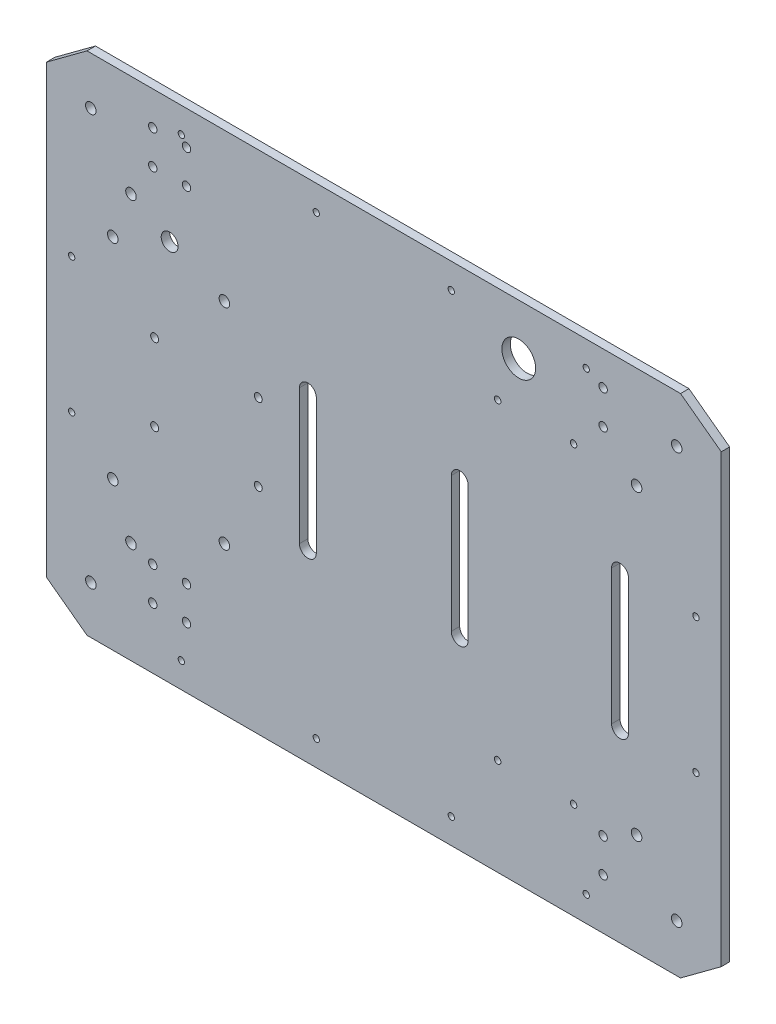
from build123d import *

# Parameters (mm, degrees)
SKETCH1_R           = 1.984375
BOSS_EXTRUDE1_DEPTH = 3.175
SKETCH2_R           = 1.213592974
CUT_EXTRUDE1_DEPTH  = 159.781746826
SKETCH5_R           = 3.175
SKETCH5_R_2         = 6.35
SKETCH5_R_3         = 1.5875
SKETCH5_R_4         = 1.984375
SKETCH5_R_5         = 1.5
CUT_EXTRUDE2_DEPTH  = 159.781746826
SKETCH6_R           = 1.190625
CUT_EXTRUDE3_DEPTH  = 159.781746826


with BuildPart() as part:
    # Sketch1 → Boss-Extrude1 (new body)
    with BuildSketch(Plane.XY):
        Polygon((-111.686526805, -95.25), (-127, -83.918625912), (-127, 83.918625912), (-111.686526805, 95.25), (111.686526805, 95.25), (127, 83.918625912), (127, -83.918625912), (111.686526805, -95.25), align=None)
        with Locations((-95.147512794, 56.885632681)):
            Circle(SKETCH1_R, mode=Mode.SUBTRACT)
        with Locations((-110.256011578, 77.303596941)):
            Circle(SKETCH1_R, mode=Mode.SUBTRACT)
        with Locations((110.256011578, 77.303596941)):
            Circle(SKETCH1_R, mode=Mode.SUBTRACT)
        with Locations((95.147512794, 56.885632681)):
            Circle(SKETCH1_R, mode=Mode.SUBTRACT)
        with Locations((-110.256011578, -77.303596941)):
            Circle(SKETCH1_R, mode=Mode.SUBTRACT)
        with Locations((-95.147512794, -56.885632681)):
            Circle(SKETCH1_R, mode=Mode.SUBTRACT)
        with Locations((110.256011578, -77.303596941)):
            Circle(SKETCH1_R, mode=Mode.SUBTRACT)
        with Locations((95.147512794, -56.885632681)):
            Circle(SKETCH1_R, mode=Mode.SUBTRACT)
    extrude(amount=BOSS_EXTRUDE1_DEPTH)

    # Sketch2 → Cut-Extrude1 (cut, through all)
    with BuildSketch(Plane.XY.offset(3.175)):
        with Locations((42.8625, 58.7375)):
            Circle(SKETCH2_R)
        with Locations((42.8625, -58.7375)):
            Circle(SKETCH2_R)
        with Locations((71.4375, -58.7375)):
            Circle(SKETCH2_R)
        with Locations((71.4375, 58.7375)):
            Circle(SKETCH2_R)
    extrude(amount=-CUT_EXTRUDE1_DEPTH, mode=Mode.SUBTRACT)

    # Sketch5 → Cut-Extrude2 (cut, through all)
    with BuildSketch(Plane(origin=(0, 0, 0), x_dir=(-1, 0, 0), z_dir=(0, 0, -1))):
        with BuildLine():
            Line((-85.725, -25.4), (-85.725, 25.4))
            ThreePointArc((-85.725, 25.4), (-88.9, 28.575), (-92.075, 25.4))
            Line((-92.075, 25.4), (-92.075, -25.4))
            ThreePointArc((-92.075, -25.4), (-88.9, -28.575), (-85.725, -25.4))
        make_face()
        with BuildLine():
            Line((-25.4, -25.4), (-25.4, 25.4))
            ThreePointArc((-25.4, 25.4), (-28.575, 28.575), (-31.75, 25.4))
            Line((-31.75, 25.4), (-31.75, -25.4))
            ThreePointArc((-31.75, -25.4), (-28.575, -28.575), (-25.4, -25.4))
        make_face()
        with BuildLine():
            ThreePointArc((31.75, 25.4), (28.575, 28.575), (25.4, 25.4))
            Line((25.4, 25.4), (25.4, -25.4))
            ThreePointArc((25.4, -25.4), (28.575, -28.575), (31.75, -25.4))
            Line((31.75, -25.4), (31.75, 25.4))
        make_face()
        with Locations((80.594630637, 48.58004)):
            Circle(SKETCH5_R)
        with Locations((-50.8, 76.2)):
            Circle(SKETCH5_R_2)
        with Locations((74.244630637, 69.85)):
            Circle(SKETCH5_R_3)
        with Locations((74.244630637, 82.55)):
            Circle(SKETCH5_R_3)
        with Locations((74.244630637, -72.39)):
            Circle(SKETCH5_R_3)
        with Locations((74.244630637, -59.69)):
            Circle(SKETCH5_R_3)
        with Locations((86.944630637, -72.39)):
            Circle(SKETCH5_R_3)
        with Locations((86.944630637, -59.69)):
            Circle(SKETCH5_R_3)
        with Locations((86.944630637, 82.55)):
            Circle(SKETCH5_R_3)
        with Locations((86.944630637, 69.85)):
            Circle(SKETCH5_R_3)
        with Locations((59.995230637, 39.49954)):
            Circle(SKETCH5_R_4)
        with Locations((101.994130637, 39.49954)):
            Circle(SKETCH5_R_4)
        with Locations((59.995230637, -39.49954)):
            Circle(SKETCH5_R_4)
        with Locations((101.994130637, -39.49954)):
            Circle(SKETCH5_R_4)
        with Locations((-82.55, -63.482384126)):
            Circle(SKETCH5_R_3)
        with Locations((-82.55, -76.182384126)):
            Circle(SKETCH5_R_3)
        with Locations((-82.55, 82.55)):
            Circle(SKETCH5_R_3)
        with Locations((-82.55, 69.85)):
            Circle(SKETCH5_R_3)
        with Locations((47.236908857, 14.5)):
            Circle(SKETCH5_R_5)
        with Locations((47.236908857, -14.5)):
            Circle(SKETCH5_R_5)
        with Locations((86.236908857, -14.5)):
            Circle(SKETCH5_R_5)
        with Locations((86.236908857, 14.5)):
            Circle(SKETCH5_R_5)
    extrude(amount=-CUT_EXTRUDE2_DEPTH, mode=Mode.SUBTRACT)

    # Sketch6 → Cut-Extrude3 (cut, through all)
    with BuildSketch(Plane(origin=(0, 0, 0), x_dir=(-1, 0, 0), z_dir=(0, 0, -1))):
        with Locations((-76.2, -85.725)):
            Circle(SKETCH6_R)
        with Locations((-25.4, -85.725)):
            Circle(SKETCH6_R)
        with Locations((25.4, -85.725)):
            Circle(SKETCH6_R)
        with Locations((76.2, -85.725)):
            Circle(SKETCH6_R)
        with Locations((76.2, 85.725)):
            Circle(SKETCH6_R)
        with Locations((25.4, 85.725)):
            Circle(SKETCH6_R)
        with Locations((-25.4, 85.725)):
            Circle(SKETCH6_R)
        with Locations((-76.2, 85.725)):
            Circle(SKETCH6_R)
        with Locations((117.475, -25.4)):
            Circle(SKETCH6_R)
        with Locations((117.475, 25.4)):
            Circle(SKETCH6_R)
        with Locations((-117.475, 25.4)):
            Circle(SKETCH6_R)
        with Locations((-117.475, -25.4)):
            Circle(SKETCH6_R)
    extrude(amount=-CUT_EXTRUDE3_DEPTH, mode=Mode.SUBTRACT)


solid = part.part
